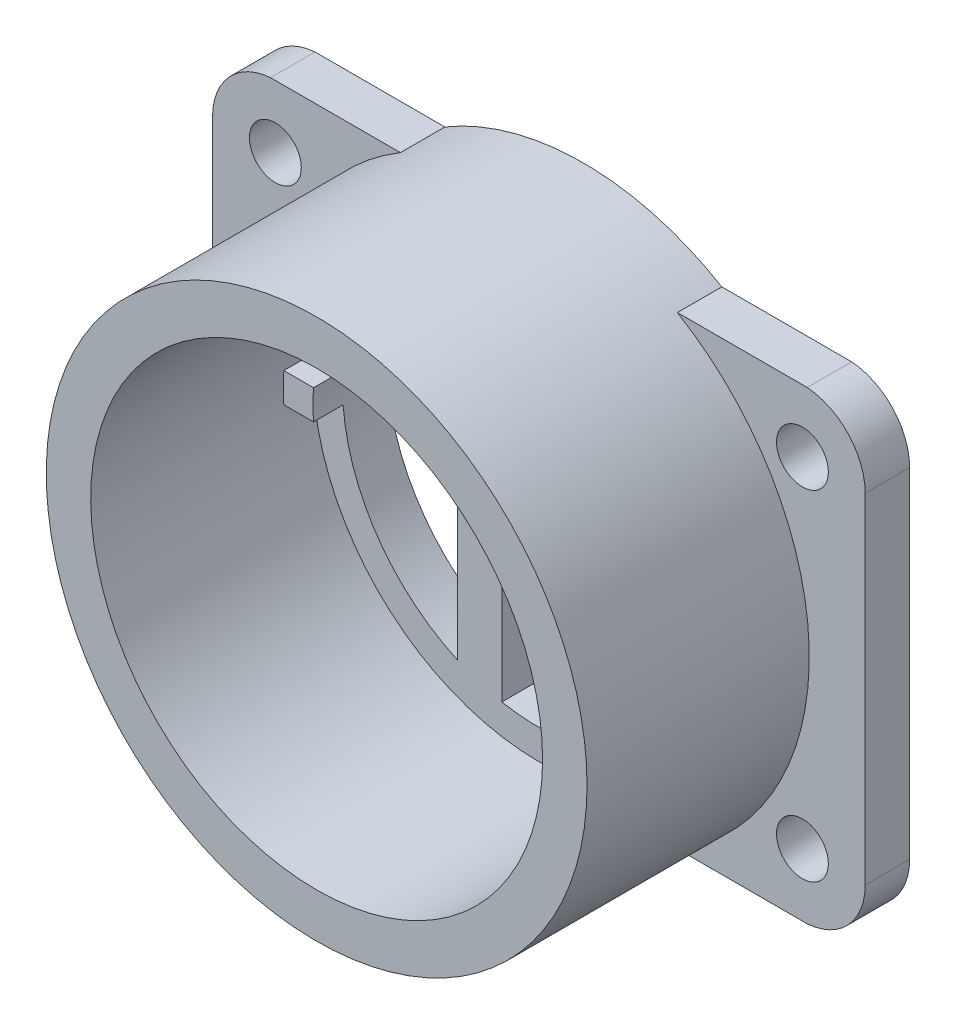
from build123d import *
from build123d.topology import SkipClean

# Parameters (mm, degrees)
SKETCH1_R                = 1.4
SKETCH1_R_2              = 13.25
BOSS_EXTRUDE1_DEPTH      = 3
SKETCH3_R                = 18.25
SKETCH3_R_2              = 15.25
BOSS_EXTRUDE2_DEPTH      = 15
BOSS_EXTRUDE4_DEPTH      = 2
BOSS_EXTRUDE5_DEPTH      = 3
CUT_EXTRUDE1_START       = -3
CUT_EXTRUDE1_OUTLINE_R   = 1.75
CUT_EXTRUDE1_OUTLINE_R_2 = 1.4
CUT_EXTRUDE1_DEPTH       = 3


# Read off the part's stored shape, not the designer's step: Cut-Extrude1
with BuildPart() as part:
    # Sketch1 → Boss-Extrude1 (new body)
    with BuildSketch(Plane.XY):
        with BuildLine():
            ThreePointArc((22.025, 11.45), (20.896729165, 14.329079757), (18.112740296, 15.675))
            Line((18.112740296, 15.675), (9.346489983, 15.675))
            ThreePointArc((9.346489983, 15.675), (0, 18.25), (-9.346489983, 15.675))
            Line((-9.346489983, 15.675), (-18.112740296, 15.675))
            ThreePointArc((-18.112740296, 15.675), (-20.896729165, 14.329079757), (-22.025, 11.45))
            Line((-22.025, 11.45), (-22.025, -11.45))
            ThreePointArc((-22.025, -11.45), (-20.896729165, -14.329079757), (-18.112740296, -15.675))
            Line((-18.112740296, -15.675), (-9.346489983, -15.675))
            ThreePointArc((-9.346489983, -15.675), (0, -18.25), (9.346489983, -15.675))
            Line((9.346489983, -15.675), (18.112740296, -15.675))
            ThreePointArc((18.112740296, -15.675), (20.896729165, -14.329079757), (22.025, -11.45))
            Line((22.025, -11.45), (22.025, 11.45))
        make_face()
        with Locations((17.7875, -11.45)):
            Circle(SKETCH1_R, mode=Mode.SUBTRACT)
        with Locations((17.7875, 11.45)):
            Circle(SKETCH1_R, mode=Mode.SUBTRACT)
        with Locations((-17.7875, 11.45)):
            Circle(SKETCH1_R, mode=Mode.SUBTRACT)
        with Locations((-17.7875, -11.45)):
            Circle(SKETCH1_R, mode=Mode.SUBTRACT)
        Circle(SKETCH1_R_2, mode=Mode.SUBTRACT)
    extrude(amount=BOSS_EXTRUDE1_DEPTH)

    # Sketch3 → Boss-Extrude2 (add)
    with BuildSketch(Plane.XY.offset(3)):
        with Locations(Location((0, 0, 0), (0, 0, 120.806241835))):
            Circle(SKETCH3_R)
        Circle(SKETCH3_R_2, mode=Mode.SUBTRACT)
    extrude(amount=BOSS_EXTRUDE2_DEPTH)

    # Sketch5 → Boss-Extrude4 (add)
    with SkipClean():  # the faces are left unmerged after this step: merging them gives an invalid solid
        with BuildSketch(Plane.XY.offset(3)):
            with BuildLine():
                ThreePointArc((-15.25, -5.3e-08), (-15.241792239, -0.500269278), (-15.217177794, -1))
                Line((-15.217177794, -1), (-13.212210262, -1))
                ThreePointArc((-13.212210262, -1), (-13.25, 0), (-13.212210262, 1))
                Line((-13.212210262, 1), (-15.217177794, 1))
                ThreePointArc((-15.217177794, 1), (-15.24179224, 0.500269225), (-15.25, -5.3e-08))
            make_face()
            with BuildLine():
                Line((13.212210262, -1), (15.217177794, -1))
                ThreePointArc((15.217177794, -1), (15.24179224, -0.500269252), (15.25, 0))
                ThreePointArc((15.25, 0), (15.24179224, 0.500269252), (15.217177794, 1))
                Line((15.217177794, 1), (13.212210262, 1))
                ThreePointArc((13.212210262, 1), (13.240549195, 0.500356889), (13.25, 0))
                ThreePointArc((13.25, 0), (13.240549195, -0.500356889), (13.212210262, -1))
            make_face()
        extrude(amount=BOSS_EXTRUDE4_DEPTH)

    # Sketch6 → Boss-Extrude5 (add)
    with SkipClean():  # the faces are left unmerged after this step: merging them gives an invalid solid
        with BuildSketch(Plane(origin=(0, 0, 0), x_dir=(-1, 0, 0), z_dir=(0, 0, -1))):
            with BuildLine():
                ThreePointArc((-5.5, -12.054563451), (-4.028545362, -12.622730381), (-2.5, -13.01201368))
                Line((-2.5, -13.01201368), (-2.5, 13.01201368))
                ThreePointArc((-2.5, 13.01201368), (-4.028545362, 12.622730381), (-5.5, 12.054563451))
                Line((-5.5, 12.054563451), (-5.5, -12.054563451))
            make_face()
            with BuildLine():
                Line((2.5, 13.01201368), (2.5, -13.01201368))
                ThreePointArc((2.5, -13.01201368), (4.028545362, -12.622730381), (5.5, -12.054563451))
                Line((5.5, -12.054563451), (5.5, 12.054563451))
                ThreePointArc((5.5, 12.054563451), (4.028545362, 12.622730381), (2.5, 13.01201368))
            make_face()
        extrude(amount=-BOSS_EXTRUDE5_DEPTH)

    # Cut-Extrude1 outline → Cut-Extrude1 (cut)
    # profile 1 of 4: a face of its own
    with SkipClean():  # the faces are left unmerged after this step: merging them gives an invalid solid
        with BuildSketch(Plane.XY.offset(3).offset(CUT_EXTRUDE1_START)):
            with Locations((-17.7875, 11.45)):
                Circle(CUT_EXTRUDE1_OUTLINE_R)
            with Locations((-17.7875, 11.45)):
                Circle(CUT_EXTRUDE1_OUTLINE_R_2, mode=Mode.SUBTRACT)
        # profile 2 of 4: a face of its own
        with BuildSketch(Plane.XY.offset(3).offset(CUT_EXTRUDE1_START)):
            with Locations((-17.7875, -11.45)):
                Circle(CUT_EXTRUDE1_OUTLINE_R)
            with Locations((-17.7875, -11.45)):
                Circle(CUT_EXTRUDE1_OUTLINE_R_2, mode=Mode.SUBTRACT)
        # profile 3 of 4: a face of its own
        with BuildSketch(Plane.XY.offset(3).offset(CUT_EXTRUDE1_START)):
            with Locations((17.7875, -11.45)):
                Circle(CUT_EXTRUDE1_OUTLINE_R)
            with Locations((17.7875, -11.45)):
                Circle(CUT_EXTRUDE1_OUTLINE_R_2, mode=Mode.SUBTRACT)
        # profile 4 of 4: a face of its own
        with BuildSketch(Plane.XY.offset(3).offset(CUT_EXTRUDE1_START)):
            with Locations((17.7875, 11.45)):
                Circle(CUT_EXTRUDE1_OUTLINE_R)
            with Locations((17.7875, 11.45)):
                Circle(CUT_EXTRUDE1_OUTLINE_R_2, mode=Mode.SUBTRACT)
        extrude(amount=CUT_EXTRUDE1_DEPTH, mode=Mode.SUBTRACT)


solid = part.part
